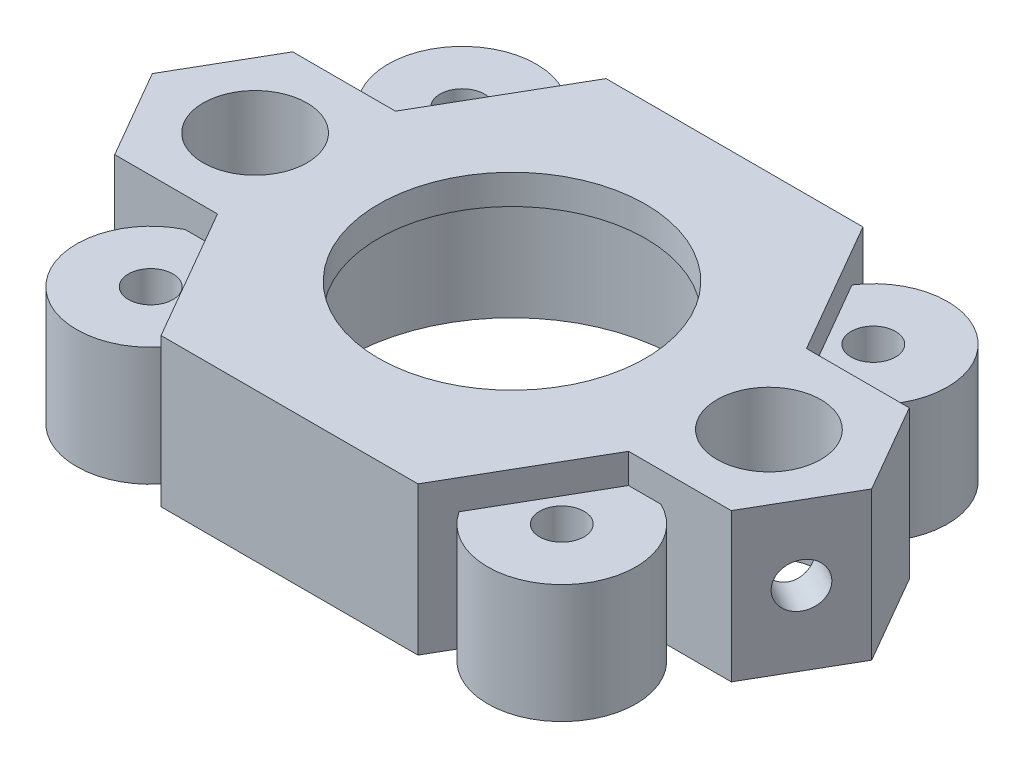
from build123d import *
from build123d.topology import SkipClean

# Parameters (mm, degrees)
SKETCH1_R                      = 1.5
SKETCH1_R_2                    = 3.5
BOSS_EXTRUDE1_DEPTH            = 8
SKETCH2_R                      = 9
SKETCH2_R_2                    = 3.5
BOSS_EXTRUDE2_DEPTH            = 2
CUT_EXTRUDE1_REACH             = 52.762
CUT_EXTRUDE1_END_RADIUS        = 3.5
SKETCH4_R                      = 1.5
CUT_EXTRUDE1_DIRECTION_2_DEPTH = 51.761698159
CUT_EXTRUDE2_REACH             = 52.762
CUT_EXTRUDE2_END_RADIUS        = 3.5
SKETCH5_R                      = 1.5


with BuildPart() as part:
    # Sketch1 → Boss-Extrude1 (new body)
    with BuildSketch(Plane(origin=(0, 0, 0), x_dir=(1, 0, 0), z_dir=(0, 1, 0))):
        with BuildLine():
            Line((9.675277915, 13.241927075), (8.660254038, 15))
            Line((8.660254038, 15), (-8.660254038, 15))
            Line((-8.660254038, 15), (-9.675277915, 13.241927075))
            ThreePointArc((-9.675277915, 13.241927075), (-17.613141308, 13.799536829), (-16.035855932, 6))
            Line((-16.035855932, 6), (-20.784609691, 6))
            Line((-20.784609691, 6), (-24.248711306, 0))
            Line((-24.248711306, 0), (-20.784609691, -6))
            Line((-20.784609691, -6), (-16.035855932, -6))
            ThreePointArc((-16.035855932, -6), (-17.613141308, -13.799536829), (-9.675277915, -13.241927075))
            Line((-9.675277915, -13.241927075), (-8.660254038, -15))
            Line((-8.660254038, -15), (8.660254038, -15))
            Line((8.660254038, -15), (9.675277915, -13.241927075))
            ThreePointArc((9.675277915, -13.241927075), (17.613141308, -13.799536829), (16.035855932, -6))
            Line((16.035855932, -6), (20.784609691, -6))
            Line((20.784609691, -6), (24.248711306, 0))
            Line((24.248711306, 0), (20.784609691, 6))
            Line((20.784609691, 6), (16.035855932, 6))
            ThreePointArc((16.035855932, 6), (17.613141308, 13.799536829), (9.675277915, 13.241927075))
        make_face()
        with Locations((-13.856406461, -10.5)):
            Circle(SKETCH1_R, mode=Mode.SUBTRACT)
        with Locations((13.856406461, -10.5)):
            Circle(SKETCH1_R, mode=Mode.SUBTRACT)
        with BuildLine():
            ThreePointArc((-13.820508076, 0), (-20.351596989, -1.75), (-15.570508076, 3.031088913))
            ThreePointArc((-15.570508076, 3.031088913), (-14.289419162, 1.75), (-13.820508076, 0))
        make_face(mode=Mode.SUBTRACT)
        with Locations((-13.856406461, 10.5)):
            Circle(SKETCH1_R, mode=Mode.SUBTRACT)
        with BuildLine():
            ThreePointArc((11.064000224, 1.163410523), (11.109739589, 0.582504296), (11.125, 0))
            ThreePointArc((11.125, 0), (-11.109739589, -0.582504296), (11.064000224, 1.163410523))
        make_face(mode=Mode.SUBTRACT)
        with Locations((17.320508076, 0)):
            Circle(SKETCH1_R_2, mode=Mode.SUBTRACT)
        with Locations((13.856406461, 10.5)):
            Circle(SKETCH1_R, mode=Mode.SUBTRACT)
    extrude(amount=BOSS_EXTRUDE1_DEPTH)

    # Sketch2 → Boss-Extrude2 (add)
    with SkipClean():  # the faces are left unmerged after this step: merging them gives an invalid solid
        with BuildSketch(Plane(origin=(0, 8, 0), x_dir=(1, 0, 0), z_dir=(0, 1, 0))):
            Polygon((8.660254038, -15), (13.856406461, -6), (20.784609691, -6), (24.248711306, 0), (20.784609691, 6), (13.856406461, 6), (8.660254038, 15), (-8.660254038, 15), (-13.856406461, 6), (-20.784609691, 6), (-24.248711306, 0), (-20.784609691, -6), (-13.856406461, -6), (-8.660254038, -15), align=None)
            Circle(SKETCH2_R, mode=Mode.SUBTRACT)
            with Locations((-17.320508076, 0)):
                Circle(SKETCH2_R_2, mode=Mode.SUBTRACT)
            with Locations((17.320508076, 0)):
                Circle(SKETCH2_R_2, mode=Mode.SUBTRACT)
        extrude(amount=BOSS_EXTRUDE2_DEPTH)

    # Cut-Extrude1: up to this cylinder (the profile starts outside it)
    cut_extrude1_end = Plane(origin=(-17.320508076, 5, 0), z_dir=(0, -1, 0)) * Cylinder(CUT_EXTRUDE1_END_RADIUS, 113.524, mode=Mode.PRIVATE)
    # Sketch4 → Cut-Extrude1 (cut, up to the surface)
    with BuildSketch(Plane(origin=(-18.186533479, 0, 10.5), x_dir=(0.500000000000001, 0, 0.866025403784438), z_dir=(-0.866025403784438, 0, 0.500000000000001)), mode=Mode.PRIVATE) as cut_extrude1_sk1:
        with Locations((-8.660254038, 5)):
            Circle(SKETCH4_R)
    cut_extrude1_tool1 = extrude(cut_extrude1_sk1.sketch, amount=-CUT_EXTRUDE1_REACH, mode=Mode.PRIVATE) - cut_extrude1_end
    add(cut_extrude1_tool1.solids().sort_by_distance((-22.51666, 5, 3))[0], mode=Mode.SUBTRACT)

    # Sketch4 → Cut-Extrude1 direction 2 (cut)
    with BuildSketch(Plane(origin=(-18.186533479, 0, 10.5), x_dir=(0.500000000000001, 0, 0.866025403784438), z_dir=(-0.866025403784438, 0, 0.500000000000001))):
        with Locations((-8.660254038, 5)):
            Circle(SKETCH4_R)
    extrude(amount=CUT_EXTRUDE1_DIRECTION_2_DEPTH, mode=Mode.SUBTRACT)

    # Cut-Extrude2: up to this cylinder (the profile starts outside it)
    cut_extrude2_end = Plane(origin=(17.320508076, 5, 0), z_dir=(0, -1, 0)) * Cylinder(CUT_EXTRUDE2_END_RADIUS, 113.524, mode=Mode.PRIVATE)
    # Sketch5 → Cut-Extrude2 (cut, up to the surface)
    with BuildSketch(Plane(origin=(18.186533479, 0, 10.5), x_dir=(0.5000000000000004, 0, -0.8660254037844384), z_dir=(0.8660254037844384, 0, 0.5000000000000004)), mode=Mode.PRIVATE) as cut_extrude2_sk1:
        with Locations((8.660254038, 5)):
            Circle(SKETCH5_R)
    cut_extrude2_tool1 = extrude(cut_extrude2_sk1.sketch, amount=-CUT_EXTRUDE2_REACH, mode=Mode.PRIVATE) - cut_extrude2_end
    add(cut_extrude2_tool1.solids().sort_by_distance((22.51666, 5, 3))[0], mode=Mode.SUBTRACT)


solid = part.part
